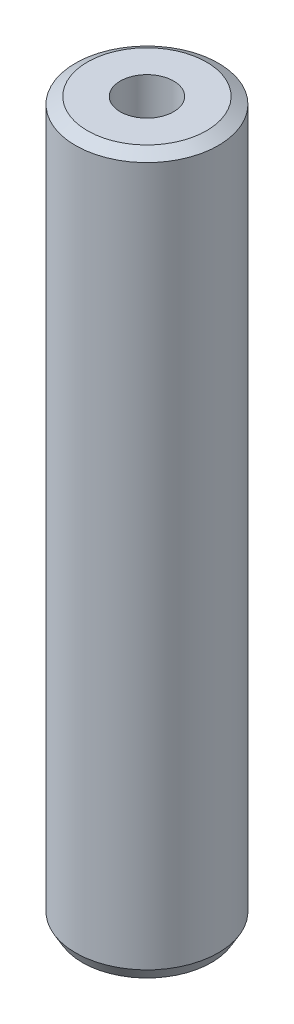
from build123d import *
from OCP.BRepFilletAPI import BRepFilletAPI_MakeChamfer

# Parameters (mm, degrees)
SKETCH1_R           = 20
BOSS_EXTRUDE1_DEPTH = 201.022569404
SKETCH2_R           = 7.470157955
CUT_EXTRUDE1_DEPTH  = 204.00264385
CHAMFER1_SIZE       = 1.921574389
CHAMFER1_SIZE2      = 3.328264472


with BuildPart() as part:
    # Sketch1 → Boss-Extrude1 (new body)
    with BuildSketch(Plane(origin=(0, 0, 0), x_dir=(1, 0, 0), z_dir=(0, 1, 0))):
        Circle(SKETCH1_R)
    extrude(amount=BOSS_EXTRUDE1_DEPTH)

    # Sketch2 → Cut-Extrude1 (cut, through all)
    with BuildSketch(Plane(origin=(0, 0, 0), x_dir=(1, 0, 0), z_dir=(0, 1, 0))):
        Circle(SKETCH2_R)
    extrude(amount=CUT_EXTRUDE1_DEPTH, mode=Mode.SUBTRACT)

    # Chamfer1: one chamfer whose edges measure the first distance from different faces: ONE call of the kernel's chamfer builder (chamfer() names one face for all edges)
    chamfer1_edges_1 = [part.edges().sort_by_distance(p)[0] for p in [
        (-20, 201.022569404, 0),
    ]]
    chamfer1_side_1 = [part.faces().sort_by_distance(p)[0] for p in [
        (-20, 100.511284702, 0),
    ]]
    chamfer1_edges_2 = [part.edges().sort_by_distance(p)[0] for p in [
        (-20, 0, 0),
    ]]
    chamfer1_side_2 = [part.faces().sort_by_distance(p)[0] for p in [
        (-19.434314575, 0, 0),
    ]]
    chamfer1 = BRepFilletAPI_MakeChamfer(part.part.solid().wrapped)
    for e in chamfer1_edges_1:
        chamfer1.Add(CHAMFER1_SIZE, CHAMFER1_SIZE2, e.wrapped, chamfer1_side_1[0].wrapped)  # the first distance lies on this face
    for e in chamfer1_edges_2:
        chamfer1.Add(CHAMFER1_SIZE, CHAMFER1_SIZE2, e.wrapped, chamfer1_side_2[0].wrapped)  # the first distance lies on this face
    add(Compound.cast(chamfer1.Shape()), mode=Mode.REPLACE)


solid = part.part
